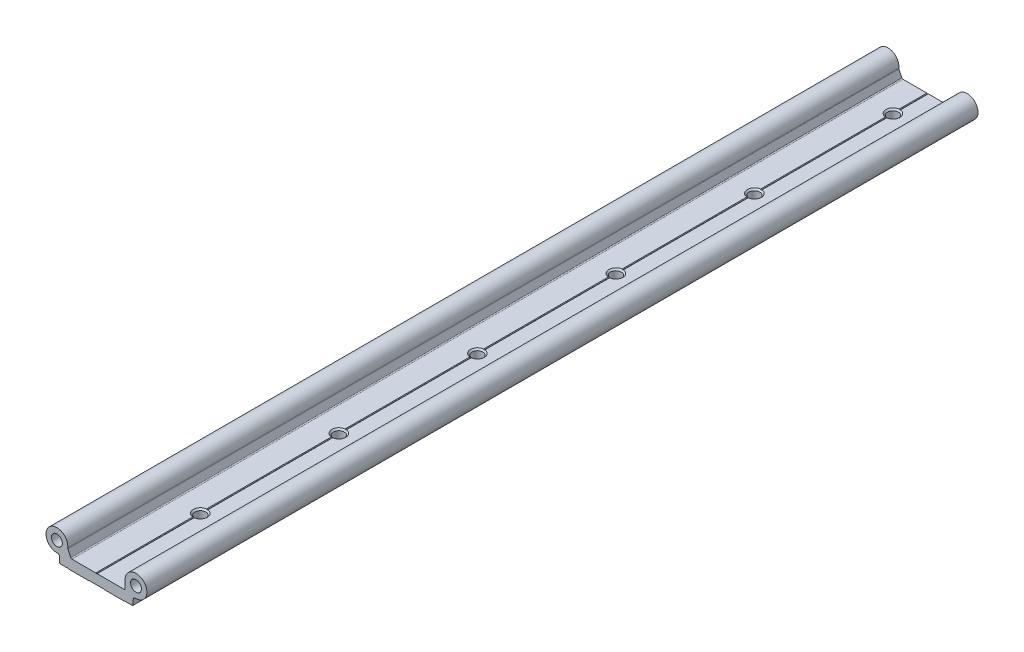
from build123d import *

# Parameters (mm, degrees)
MODEL_R                           = 3.999999997
BOSS_EXTRUDE1_DEPTH               = 609.6
F_3_8_16_TAPPED_HOLE1_D           = 7.9375
F_3_8_16_TAPPED_HOLE1_CSINK_D     = 10.16
F_3_8_16_TAPPED_HOLE1_CSINK_ANGLE = 90
CUT_EXTRUDE1_DEPTH                = 612.11795915
TAP_DRILL_FOR_0_80_TAP1_D         = 1.19126


with BuildPart() as part:
    # Model → Boss-Extrude1 (new body)
    with BuildSketch(Plane.XY):
        with BuildLine():
            Line((-18.843780991, 7.981867858), (-20.966888929, 12.534890876))
            ThreePointArc((-20.966888929, 12.534890876), (-21.047789267, 12.798072701), (-21.053849819, 13.07334131))
            ThreePointArc((-21.053849819, 13.07334131), (-34.474612004, 19.833405747), (-28.578947374, 6.011088019))
            ThreePointArc((-28.578947374, 6.011088019), (-27.4676292, 5.601381399), (-27.000000001, 4.513167022))
            Line((-27.000000001, 4.513167022), (-27.000000001, 0.700000022))
            Line((-27.000000001, 0.700000022), (-26.500000001, 0.200000022))
            Line((-26.500000001, 0.200000022), (-20.200001001, 0.200000022))
            Line((-20.200001001, 0.200000022), (-20.000000979, 0))
            Line((-20.000000979, 0), (-6.000000502, 0))
            Line((-6.000000502, 0), (-5.80000048, 0.200000022))
            Line((-5.80000048, 0.200000022), (5.80000048, 0.200000022))
            Line((5.80000048, 0.200000022), (6.000000502, 0))
            Line((6.000000502, 0), (20.000000979, 0))
            Line((20.000000979, 0), (20.200001001, 0.200000022))
            Line((20.200001001, 0.200000022), (26.500000001, 0.200000022))
            Line((26.500000001, 0.200000022), (27.000000001, 0.700000022))
            Line((27.000000001, 0.700000022), (27.000000001, 4.513167022))
            ThreePointArc((27.000000001, 4.513167022), (27.4676292, 5.601381399), (28.578947374, 6.011088019))
            ThreePointArc((28.578947374, 6.011088019), (34.474612004, 19.833405747), (21.053849819, 13.07334131))
            ThreePointArc((21.053849819, 13.07334131), (21.047789267, 12.798072701), (20.966888929, 12.534890876))
            Line((20.966888929, 12.534890876), (18.843780991, 7.981867858))
            ThreePointArc((18.843780991, 7.981867858), (18.479330527, 7.628755749), (17.98848008, 7.499999621))
            Line((17.98848008, 7.499999621), (0.500000254, 7.499999621))
            Line((0.500000254, 7.499999621), (0, 7.211324621))
            Line((0, 7.211324621), (-0.500000254, 7.499999621))
            Line((-0.500000254, 7.499999621), (-17.98848008, 7.499999621))
            ThreePointArc((-17.98848008, 7.499999621), (-18.479330527, 7.628755749), (-18.843780991, 7.981867858))
        make_face()
        with Locations((-29.000000026, 13.999999962)):
            Circle(MODEL_R, mode=Mode.SUBTRACT)
        with Locations((29.000000026, 13.999999962)):
            Circle(MODEL_R, mode=Mode.SUBTRACT)
    extrude(amount=BOSS_EXTRUDE1_DEPTH)

    # 3/8-16 Tapped Hole1 (through all)
    with Locations(Plane(origin=(0, 7.499999621, 0), x_dir=(1, 0, 0), z_dir=(0, 1, 0))):
        with Locations((0, -25.4), (0, -127), (0, -228.6), (0, -330.2), (0, -431.8), (0, -533.4), (0, -635), (0, -736.6), (0, -838.2), (0, -939.8), (0, -1041.4), (0, -1143), (0, -1244.6), (0, -1346.2), (0, -1447.8), (0, -1549.4), (0, -1651), (0, -1752.6), (0, -1854.2), (0, -1955.8)):
            CounterSinkHole(F_3_8_16_TAPPED_HOLE1_D / 2, F_3_8_16_TAPPED_HOLE1_CSINK_D / 2, counter_sink_angle=F_3_8_16_TAPPED_HOLE1_CSINK_ANGLE)

    # Sketch3 → Cut-Extrude1 (cut, through all)
    with BuildSketch(Plane(origin=(0, 0, 0), x_dir=(-1, 0, 0), z_dir=(0, 0, -1))):
        Polygon((-17.98848008, 7.499999621), (-21.053849819, 7.499999621), (-21.053849819, 13.07334131), align=None)
    extrude(amount=-CUT_EXTRUDE1_DEPTH, mode=Mode.SUBTRACT)

    # Tap Drill for #0-80 Tap1 (through all)
    with Locations(Plane(origin=(0, 7.499999621, 0), x_dir=(1, 0, 0), z_dir=(0, 1, 0))):
        with Locations((19.402849819, -3.309755123), (19.402849819, -103.055555123), (19.402849819, -202.801355123), (19.402849819, -302.547155123), (19.402849819, -402.292955123), (19.402849819, -502.038755123), (19.402849819, -601.784555123), (19.402849819, -701.530355123), (19.402849819, -801.276155123), (19.402849819, -901.021955123)):
            Hole(TAP_DRILL_FOR_0_80_TAP1_D / 2)


solid = part.part
